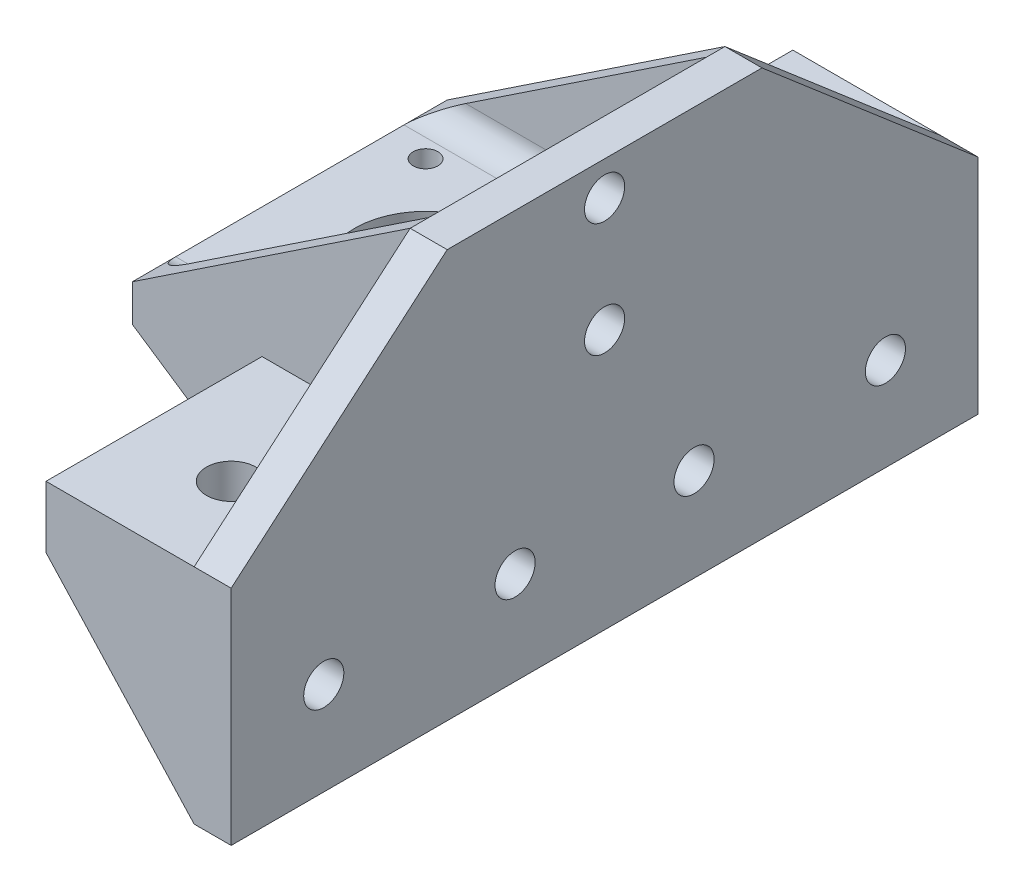
from build123d import *
from OCP.BRepFilletAPI import BRepFilletAPI_MakeFillet

# Parameters (mm, degrees)
SKETCH2_W                  = 45
SKETCH2_H                  = 45
BOSS_EXTRUDE1_DEPTH        = 6
SKETCH4_R                  = 11.5
SKETCH4_R_2                = 2
CUT_EXTRUDE1_DEPTH         = 64.921827258
BOSS_EXTRUDE2_DEPTH        = 30.1
BOSS_EXTRUDE2_DEPTH_BACK   = 36
SKETCH5_W                  = 6
SKETCH5_H                  = 45
BOSS_EXTRUDE3_DEPTH        = 3
BOSS_EXTRUDE4_DEPTH        = 3
BOSS_EXTRUDE5_DEPTH        = 30
BOSS_EXTRUDE6_DEPTH        = 5
FILLET3_R                  = 10
FILLET4_R1                 = 4
FILLET4_R2                 = 2
FILLET4_R3                 = 1.2
FILLET4_R4                 = 1.5
BOSS_EXTRUDE7_DEPTH        = 30
BOSS_EXTRUDE8_DEPTH        = 5
FILLET5_R                  = 10
F_6_5_6_5_DIAMETER_HOLE1_D = 6.5
SKETCH14_R                 = 4
CUT_EXTRUDE2_DEPTH         = 7.5
BOSS_EXTRUDE9_DEPTH        = 6


with BuildPart() as part:
    # Sketch2 → Boss-Extrude1 (new body)
    with BuildSketch(Plane(origin=(0, 0, 0), x_dir=(1, 0, 0), z_dir=(0, 1, 0))):
        with Locations((22.5, 22.5)):
            Rectangle(SKETCH2_W, SKETCH2_H)
    extrude(amount=BOSS_EXTRUDE1_DEPTH)

    # Sketch4 → Cut-Extrude1 (cut, through all)
    with BuildSketch(Plane(origin=(0, 6, 0), x_dir=(-1, 0, 0), z_dir=(0, 1, 0))):
        with Locations((-22, -22.5)):
            Circle(SKETCH4_R)
        with Locations((-37.5, -7)):
            Circle(SKETCH4_R_2)
        with Locations((-6.5, -7)):
            Circle(SKETCH4_R_2)
        with Locations((-6.5, -38)):
            Circle(SKETCH4_R_2)
        with Locations((-37.5, -38)):
            Circle(SKETCH4_R_2)
    extrude(amount=-CUT_EXTRUDE1_DEPTH, mode=Mode.SUBTRACT)

    # Sketch5 → Boss-Extrude2 (add, two sides: drawn at the far end of the back side and taken through both)
    with BuildSketch(Plane.XZ.offset(-BOSS_EXTRUDE2_DEPTH_BACK)):
        with Locations((48, -22.5)):
            Rectangle(SKETCH5_W, SKETCH5_H)
    extrude(amount=BOSS_EXTRUDE2_DEPTH + BOSS_EXTRUDE2_DEPTH_BACK)

    # Sketch8 → Boss-Extrude3 (add)
    with BuildSketch(Plane.XY):
        Polygon((45, 36), (0, 6), (0, 0), (45, -30.1), (51, -30.1), (51, 36), align=None)
    extrude(amount=BOSS_EXTRUDE3_DEPTH)

    # Sketch9 → Boss-Extrude4 (add)
    with BuildSketch(Plane(origin=(0, 0, -45), x_dir=(-1, 0, 0), z_dir=(0, 0, -1))):
        Polygon((0, 6), (-45, 36), (-51, 36), (-51, -30.1), (-45, -30.1), (0, 0), align=None)
    extrude(amount=BOSS_EXTRUDE4_DEPTH)

    # Sketch11 → Boss-Extrude5 (add)
    with BuildSketch(Plane.XY.offset(3)):
        Polygon((51, -30.1), (45, -30.1), (45, -4), (21, -4), (21, 6), (51, 6), align=None)
    extrude(amount=BOSS_EXTRUDE5_DEPTH)

    # Sketch12 → Boss-Extrude6 (add)
    with BuildSketch(Plane.XY.offset(33)):
        Polygon((45, -30.1), (21, -4), (21, 6), (51, 6), (51, -30.1), align=None)
    extrude(amount=BOSS_EXTRUDE6_DEPTH)

    # Fillet3
    fillet3_edges = [part.edges().sort_by_distance(p)[0] for p in [
        (33, -4, 33),
        (33, -4, 3),
    ]]
    fillet(fillet3_edges, radius=FILLET3_R)

    # Fillet4: one fillet with a radius per group of edges: ONE call of the kernel's fillet builder (fillet() takes one radius for all edges)
    fillet4_edges_1 = [part.edges().sort_by_distance(p)[0] for p in [
        (22.5, 6, -45),
        (22.5, 6, 0),
    ]]
    fillet4_edges_2 = [part.edges().sort_by_distance(p)[0] for p in [
        (45, 6, -22.5),
    ]]
    fillet4_edges_3 = [part.edges().sort_by_distance(p)[0] for p in [
        (22.5, 0, -45),
        (22.5, 0, 0),
    ]]
    fillet4_edges_4 = [part.edges().sort_by_distance(p)[0] for p in [
        (45, 0, -22.5),
    ]]
    fillet4 = BRepFilletAPI_MakeFillet(part.part.solid().wrapped)
    for e in fillet4_edges_1:
        fillet4.Add(FILLET4_R1, e.wrapped)
    for e in fillet4_edges_2:
        fillet4.Add(FILLET4_R2, e.wrapped)
    for e in fillet4_edges_3:
        fillet4.Add(FILLET4_R3, e.wrapped)
    for e in fillet4_edges_4:
        fillet4.Add(FILLET4_R4, e.wrapped)
    add(Compound.cast(fillet4.Shape()), mode=Mode.REPLACE)

    # Sketch15 → Boss-Extrude7 (add)
    with BuildSketch(Plane(origin=(0, 0, -48), x_dir=(-1, 0, 0), z_dir=(0, 0, -1))):
        Polygon((-51, -30.1), (-51, 6), (-21, 6), (-21, -4), (-45, -4), (-45, -30.1), align=None)
    extrude(amount=BOSS_EXTRUDE7_DEPTH)

    # Sketch16 → Boss-Extrude8 (add)
    with BuildSketch(Plane(origin=(0, 0, -78), x_dir=(-1, 0, 0), z_dir=(0, 0, -1))):
        Polygon((-45, -30.1), (-21, -4), (-21, 6), (-51, 6), (-51, -30.1), align=None)
    extrude(amount=BOSS_EXTRUDE8_DEPTH)

    # Fillet5
    fillet5_edges = [part.edges().sort_by_distance(p)[0] for p in [
        (33, -4, -48),
        (33, -4, -78),
    ]]
    fillet(fillet5_edges, radius=FILLET5_R)

    # Ø6.5 (6.5) Diameter Hole1 (through all)
    with Locations(Plane.ZY.offset(-45)):
        with Locations((-22.5, 12), (-22.5, 30.5), (-37, -15), (-8, -15), (23, -15), (-68, -15)):
            Hole(F_6_5_6_5_DIAMETER_HOLE1_D / 2)

    # Sketch14 → Cut-Extrude2 (cut)
    with BuildSketch(Plane(origin=(0, 6, 0), x_dir=(1, 0, 0), z_dir=(0, 1, 0))):
        with Locations((36, -23)):
            Circle(SKETCH14_R)
        with Locations((36, 68)):
            Circle(SKETCH14_R)
    extrude(amount=-CUT_EXTRUDE2_DEPTH, mode=Mode.SUBTRACT)

    # Sketch17 → Boss-Extrude9 (add)
    with BuildSketch(Plane(origin=(51, 0, 0), x_dir=(0, 0, -1), z_dir=(1, 0, 0))):
        Polygon((-3, 36), (-38, 6), (-3, 6), align=None)
        Polygon((48, 36), (83, 6), (48, 6), align=None)
    extrude(amount=-BOSS_EXTRUDE9_DEPTH)


solid = part.part
